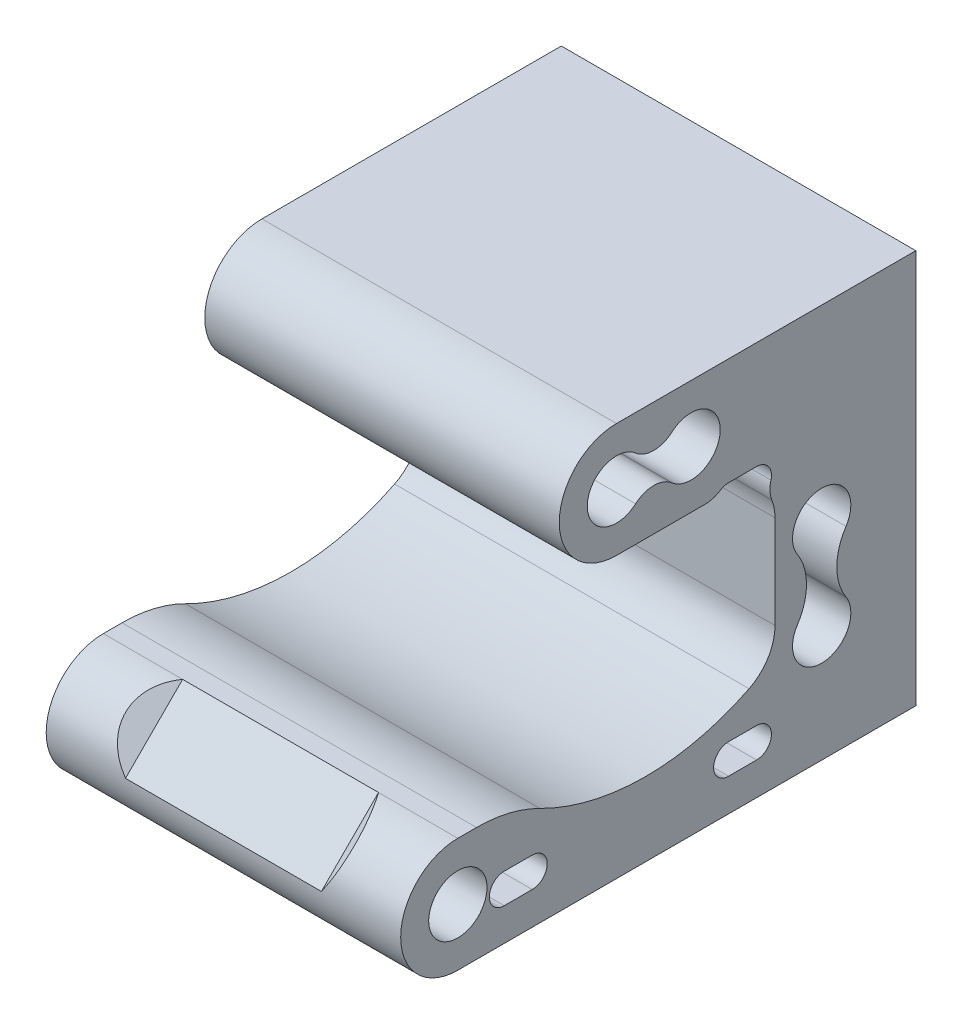
from build123d import *

# Parameters (mm, degrees)
SKETCH1_R               = 3.125
BOSS_EXTRUDE1_DEPTH     = 19
CUT_EXTRUDE1_DEPTH      = 43.878318603
CUT_EXTRUDE1_DEPTH_BACK = 43.878318603
CUT_EXTRUDE2_START      = -19
CUT_EXTRUDE2_DEPTH      = 4
FILLET2_R               = 3
CUT_EXTRUDE6_DEPTH      = 12.5
CHAMFER1_SIZE           = 2


with BuildPart() as part:
    # Sketch1 → Boss-Extrude1 (new, symmetric)
    # profile 1 of 2: a face of its own
    with BuildSketch(Plane(origin=(0, 0, 0), x_dir=(0, 0, -1), z_dir=(1, 0, 0))):
        with BuildLine():
            ThreePointArc((-26.125, -11), (-24.331029035, -15.331029035), (-20, -17.125))
            Line((-20, -17.125), (29.090970785, -17.125))
            Line((29.090970785, -17.125), (29.090970785, 25.125))
            Line((29.090970785, 25.125), (-3, 25.125))
            ThreePointArc((-3, 25.125), (-9.125, 19), (-3, 12.875))
            Line((-3, 12.875), (9, 12.875))
            ThreePointArc((9, 12.875), (12.535533906, 11.410533906), (14, 7.875))
            Line((14, 7.875), (14, -2.125))
            ThreePointArc((14, -2.125), (13.249270274, -4.760090537), (11.222519145, -6.603884755))
            ThreePointArc((11.222519145, -6.603884755), (-0.005385096, -9.209195056), (-11.208778717, -6.500422867))
            ThreePointArc((-11.208778717, -6.500422867), (-14.508485787, -5.287014241), (-18, -4.875))
            Line((-18, -4.875), (-20, -4.875))
            Line((-20, -4.875), (-26.125, -11))
        make_face()
        with Locations((-20, -11)):
            Circle(SKETCH1_R, mode=Mode.SUBTRACT)
        with BuildLine():
            ThreePointArc((16.391055046, 3.279816514), (18.102037858, 7.993207141), (22.125, 5))
            ThreePointArc((22.125, 5), (21.993207141, 4.102037858), (21.608944954, 3.279816514))
            ThreePointArc((21.608944954, 3.279816514), (20.625, 0), (21.608944954, -3.279816514))
            ThreePointArc((21.608944954, -3.279816514), (21.993207141, -4.102037858), (22.125, -5))
            ThreePointArc((22.125, -5), (18.102037858, -7.993207141), (16.391055046, -3.279816514))
            ThreePointArc((16.391055046, -3.279816514), (17.375, 0), (16.391055046, 3.279816514))
        make_face(mode=Mode.SUBTRACT)
        with BuildLine():
            ThreePointArc((-0.945205479, 16.645547945), (-6.125, 19), (-0.945205479, 21.354452055))
            ThreePointArc((-0.945205479, 21.354452055), (1, 20.625), (2.945205479, 21.354452055))
            ThreePointArc((2.945205479, 21.354452055), (6.293134201, 21.844895242), (8.125, 19))
            ThreePointArc((8.125, 19), (6.293134201, 16.155104758), (2.945205479, 16.645547945))
            ThreePointArc((2.945205479, 16.645547945), (1, 17.375), (-0.945205479, 16.645547945))
        make_face(mode=Mode.SUBTRACT)
    # profile 2 of 2: a face of its own
    with BuildSketch(Plane(origin=(0, 0, 0), x_dir=(0, 0, -1), z_dir=(1, 0, 0))):
        with BuildLine():
            ThreePointArc((-20, -4.875), (-24.331029035, -6.668970965), (-26.125, -11))
            Line((-26.125, -11), (-20, -4.875))
        make_face()
    extrude(amount=BOSS_EXTRUDE1_DEPTH, both=True)

    # Sketch2 → Cut-Extrude1 (cut, two sides: drawn at the far end of the back side and taken through both)
    with BuildSketch(Plane(origin=(0, 0, 0), x_dir=(0, 0, -1), z_dir=(1, 0, 0)).offset(-CUT_EXTRUDE1_DEPTH_BACK)):
        with BuildLine():
            Line((-12.02081528, 13.62081528), (-15.02081528, 13.62081528))
            ThreePointArc((-15.02081528, 13.62081528), (-16.62081528, 12.02081528), (-15.02081528, 10.42081528))
            Line((-15.02081528, 10.42081528), (-12.02081528, 10.42081528))
            ThreePointArc((-12.02081528, 10.42081528), (-10.42081528, 12.02081528), (-12.02081528, 13.62081528))
        make_face()
        with BuildLine():
            Line((12.02081528, 13.62081528), (9.02081528, 13.62081528))
            ThreePointArc((9.02081528, 13.62081528), (7.42081528, 12.02081528), (9.02081528, 10.42081528))
            Line((9.02081528, 10.42081528), (12.02081528, 10.42081528))
            ThreePointArc((12.02081528, 10.42081528), (13.62081528, 12.02081528), (12.02081528, 13.62081528))
        make_face()
        with BuildLine():
            Line((12.02081528, -10.42081528), (9.02081528, -10.42081528))
            ThreePointArc((9.02081528, -10.42081528), (7.42081528, -12.02081528), (9.02081528, -13.62081528))
            Line((9.02081528, -13.62081528), (12.02081528, -13.62081528))
            ThreePointArc((12.02081528, -13.62081528), (13.62081528, -12.02081528), (12.02081528, -10.42081528))
        make_face()
        with BuildLine():
            Line((-12.02081528, -10.42081528), (-15.02081528, -10.42081528))
            ThreePointArc((-15.02081528, -10.42081528), (-16.62081528, -12.02081528), (-15.02081528, -13.62081528))
            Line((-15.02081528, -13.62081528), (-12.02081528, -13.62081528))
            ThreePointArc((-12.02081528, -13.62081528), (-10.42081528, -12.02081528), (-12.02081528, -10.42081528))
        make_face()
    extrude(amount=CUT_EXTRUDE1_DEPTH + CUT_EXTRUDE1_DEPTH_BACK, mode=Mode.SUBTRACT)

    # Sketch2<3> → Cut-Extrude2 (cut)
    # profile 1 of 4: a face of its own
    with BuildSketch(Plane(origin=(0, 0, 0), x_dir=(0, 0, -1), z_dir=(1, 0, 0)).offset(CUT_EXTRUDE2_START)):
        with BuildLine():
            Line((-12.02081528, 9.02081528), (-15.02081528, 9.02081528))
            ThreePointArc((-15.02081528, 9.02081528), (-18.02081528, 12.02081528), (-15.02081528, 15.02081528))
            Line((-15.02081528, 15.02081528), (-12.02081528, 15.02081528))
            ThreePointArc((-12.02081528, 15.02081528), (-9.02081528, 12.02081528), (-12.02081528, 9.02081528))
        make_face()
        with BuildLine():
            Line((-12.02081528, 10.42081528), (-15.02081528, 10.42081528))
            ThreePointArc((-15.02081528, 10.42081528), (-16.62081528, 12.02081528), (-15.02081528, 13.62081528))
            Line((-15.02081528, 13.62081528), (-12.02081528, 13.62081528))
            ThreePointArc((-12.02081528, 13.62081528), (-10.42081528, 12.02081528), (-12.02081528, 10.42081528))
        make_face(mode=Mode.SUBTRACT)
    # profile 2 of 4: a face of its own
    with BuildSketch(Plane(origin=(0, 0, 0), x_dir=(0, 0, -1), z_dir=(1, 0, 0)).offset(CUT_EXTRUDE2_START)):
        with BuildLine():
            Line((-12.02081528, -15.02081528), (-15.02081528, -15.02081528))
            ThreePointArc((-15.02081528, -15.02081528), (-18.02081528, -12.02081528), (-15.02081528, -9.02081528))
            Line((-15.02081528, -9.02081528), (-12.02081528, -9.02081528))
            ThreePointArc((-12.02081528, -9.02081528), (-9.02081528, -12.02081528), (-12.02081528, -15.02081528))
        make_face()
        with BuildLine():
            Line((-12.02081528, -13.62081528), (-15.02081528, -13.62081528))
            ThreePointArc((-15.02081528, -13.62081528), (-16.62081528, -12.02081528), (-15.02081528, -10.42081528))
            Line((-15.02081528, -10.42081528), (-12.02081528, -10.42081528))
            ThreePointArc((-12.02081528, -10.42081528), (-10.42081528, -12.02081528), (-12.02081528, -13.62081528))
        make_face(mode=Mode.SUBTRACT)
    # profile 3 of 4: a face of its own
    with BuildSketch(Plane(origin=(0, 0, 0), x_dir=(0, 0, -1), z_dir=(1, 0, 0)).offset(CUT_EXTRUDE2_START)):
        with BuildLine():
            Line((12.02081528, -15.02081528), (9.02081528, -15.02081528))
            ThreePointArc((9.02081528, -15.02081528), (6.02081528, -12.02081528), (9.02081528, -9.02081528))
            Line((9.02081528, -9.02081528), (12.02081528, -9.02081528))
            ThreePointArc((12.02081528, -9.02081528), (15.02081528, -12.02081528), (12.02081528, -15.02081528))
        make_face()
        with BuildLine():
            Line((12.02081528, -13.62081528), (9.02081528, -13.62081528))
            ThreePointArc((9.02081528, -13.62081528), (7.42081528, -12.02081528), (9.02081528, -10.42081528))
            Line((9.02081528, -10.42081528), (12.02081528, -10.42081528))
            ThreePointArc((12.02081528, -10.42081528), (13.62081528, -12.02081528), (12.02081528, -13.62081528))
        make_face(mode=Mode.SUBTRACT)
    # profile 4 of 4: a face of its own
    with BuildSketch(Plane(origin=(0, 0, 0), x_dir=(0, 0, -1), z_dir=(1, 0, 0)).offset(CUT_EXTRUDE2_START)):
        with BuildLine():
            Line((12.02081528, 9.02081528), (9.02081528, 9.02081528))
            ThreePointArc((9.02081528, 9.02081528), (6.02081528, 12.02081528), (9.02081528, 15.02081528))
            Line((9.02081528, 15.02081528), (12.02081528, 15.02081528))
            ThreePointArc((12.02081528, 15.02081528), (15.02081528, 12.02081528), (12.02081528, 9.02081528))
        make_face()
        with BuildLine():
            Line((12.02081528, 10.42081528), (9.02081528, 10.42081528))
            ThreePointArc((9.02081528, 10.42081528), (7.42081528, 12.02081528), (9.02081528, 13.62081528))
            Line((9.02081528, 13.62081528), (12.02081528, 13.62081528))
            ThreePointArc((12.02081528, 13.62081528), (13.62081528, 12.02081528), (12.02081528, 10.42081528))
        make_face(mode=Mode.SUBTRACT)
    extrude(amount=CUT_EXTRUDE2_DEPTH, mode=Mode.SUBTRACT)

    # Fillet2
    fillet2_edges = [part.edges().sort_by_distance(p)[0] for p in [
        (2, 10.800069224, -13.055116526),
        (-17, 9.543812481, -13.713285998),
        (-17, 12.875, -6.144990448),
        (-17, -13.199102102, 17.779735389),
        (-17, -9.851965995, 17.093517087),
        (2, 12.875, -7.667904173),
    ]]
    fillet(fillet2_edges, radius=FILLET2_R)

    # Sketch1<4> → Cut-Extrude6 (cut, symmetric)
    with BuildSketch(Plane(origin=(0, 0, 0), x_dir=(0, 0, -1), z_dir=(1, 0, 0))):
        with BuildLine():
            ThreePointArc((-20, -4.875), (-24.331029035, -6.668970965), (-26.125, -11))
            Line((-26.125, -11), (-20, -4.875))
        make_face()
    extrude(amount=CUT_EXTRUDE6_DEPTH, both=True, mode=Mode.SUBTRACT)

    # Chamfer1
    # the kernel refuses this chamfer: 2 mm, written as the material it adds along each edge
    with BuildSketch(Plane(origin=(12.5, -14.63690896, 29.76190896), x_dir=(-0.9996219169112968, -0.01944252080601336, -0.019442520806013355), z_dir=(0, 0.7071067811865475, -0.7071067811865476))) as chamfer1_piece_1_section:
        Polygon((CHAMFER1_SIZE * 0.999621916911, CHAMFER1_SIZE * 0.0274958766106), (-CHAMFER1_SIZE * 0.0274958766106, CHAMFER1_SIZE * 0.999621916911), (0, 0), align=None)
    chamfer1_piece_1 = extrude(amount=18.948790021, mode=Mode.PRIVATE)
    chamfer1_piece_1 = chamfer1_piece_1 & Plane(origin=(11.776447372, -11, 20), x_dir=(0, 0, 1), z_dir=(1, 0, 0)) * Cylinder(6.125, 46, mode=Mode.PRIVATE)
    add(chamfer1_piece_1)
    with BuildSketch(Plane(origin=(-12.5, -14.63690896, 29.76190896), x_dir=(0.9996219169112968, -0.01944252080601336, -0.019442520806013355), z_dir=(0, 0.7071067811865475, -0.7071067811865476))) as chamfer1_piece_2_section:
        Polygon((CHAMFER1_SIZE * 0.999621916911, -CHAMFER1_SIZE * 0.0274958766106), (-CHAMFER1_SIZE * 0.0274958766106, -CHAMFER1_SIZE * 0.999621916911), (0, 0), align=None)
    chamfer1_piece_2 = extrude(amount=18.948790021, mode=Mode.PRIVATE)
    chamfer1_piece_2 = chamfer1_piece_2 & Plane(origin=(-11.776447372, -11, 20), x_dir=(0, 0, 1), z_dir=(1, 0, 0)) * Cylinder(6.125, 46, mode=Mode.PRIVATE)
    add(chamfer1_piece_2)


solid = part.part
